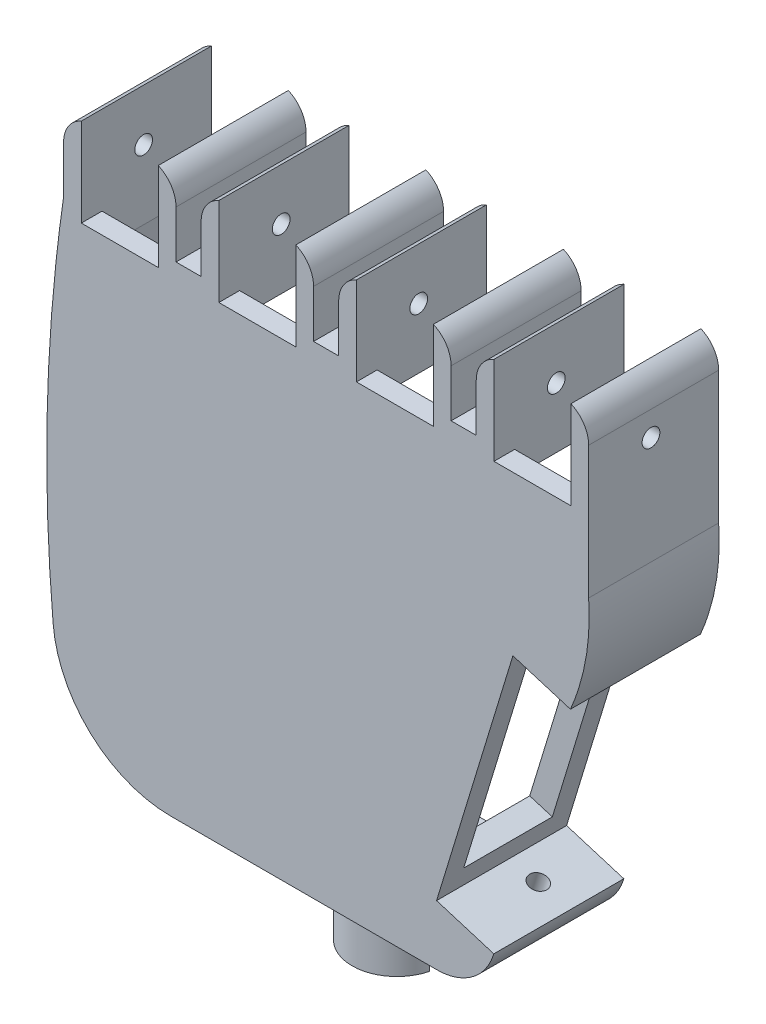
from build123d import *

# Parameters (mm, degrees)
BOSS_EXTRUDE3_DEPTH      = 22
SHELL4_DEPTH             = 18
FILLET1_R                = 5
FILLET2_R                = 5
SKETCH31_W               = 1.5
SKETCH31_H               = 76.806640353
F_3_0_3_DIAMETER_HOLE7_D = 3
SKETCH37_W               = 15
SKETCH37_H               = 36.56625109
CUT_EXTRUDE1_DEPTH       = 10
SKETCH41_W               = 13.02442257
SKETCH41_H               = 15
CUT_EXTRUDE2_DEPTH       = 10
SKETCH41_3_W             = 13.02442257
SKETCH41_3_H             = 15
SKETCH41_3_W_2           = 13.024422569
CUT_EXTRUDE3_DEPTH       = 10
SKETCH44_R               = 7.6
BOSS_EXTRUDE4_DEPTH      = 10
CUT_EXTRUDE12_DEPTH      = 2
CUT_EXTRUDE15_DEPTH      = 12
CUT_EXTRUDE15_DEPTH_BACK = 8
SKETCH65_R               = 2
CUT_EXTRUDE16_START      = -15
SKETCH66_W               = 24.080124388
SKETCH66_H               = 1.338456146
SKETCH66_W_2             = 24.117878097
SKETCH66_H_2             = 1.371234816
CUT_EXTRUDE16_DEPTH      = 10.176313


# Read off the part's stored shape, not the designer's step: Shell4
with BuildPart() as part:
    # Sketch3 → Boss-Extrude3 (new body)
    with BuildSketch(Plane.XY):
        with BuildLine():
            Line((-47.418265466, -62.043210219), (-2.360270573, -62.043210219))
            ThreePointArc((-2.360270573, -62.043210219), (3.711249355, -59.989067364), (7.288415427, -54.670539374))
            Line((7.288415427, -54.670539374), (-2.39285592, -51.717270677))
            Line((-2.39285592, -51.717270677), (10.318728653, -10.046731303))
            Line((10.318728653, -10.046731303), (20, -13))
            add(Edge.make_bspline(
                [(23.274501304, 5.279065965), (23.919221397, -4.143444375), (20, -13)],
                knots=[0, 0, 0, 1, 1, 1], degree=2))
            Line((23.274501304, 5.279065965), (23.274501304, 32.247436741))
            Line((23.274501304, 32.247436741), (20.274501304, 32.247436741))
            Line((20.274501304, 32.247436741), (20.274501304, 17.29592652))
            Line((20.274501304, 17.29592652), (7.250078734, 17.29592652))
            Line((7.250078734, 17.29592652), (7.250078734, 32.247436741))
            Line((7.250078734, 32.247436741), (4.250078734, 32.247436741))
            Line((4.250078734, 32.247436741), (4.250078734, 19.60306742))
            Line((4.250078734, 19.60306742), (0, 19.60306742))
            Line((0, 19.60306742), (0, 32.247436741))
            Line((0, 32.247436741), (-3, 32.247436741))
            Line((-3, 32.247436741), (-3, 17.29592652))
            Line((-3, 17.29592652), (-16.02442257, 17.29592652))
            Line((-16.02442257, 17.29592652), (-16.02442257, 32.247436741))
            Line((-16.02442257, 32.247436741), (-19.02442257, 32.247436741))
            Line((-19.02442257, 32.247436741), (-19.02442257, 19.60306742))
            Line((-19.02442257, 19.60306742), (-23.274501304, 19.60306742))
            Line((-23.274501304, 19.60306742), (-23.274501304, 32.247436741))
            Line((-23.274501304, 32.247436741), (-26.274501304, 32.247436741))
            Line((-26.274501304, 32.247436741), (-26.274501304, 17.29592652))
            Line((-26.274501304, 17.29592652), (-39.298923873, 17.29592652))
            Line((-39.298923873, 17.29592652), (-39.298923873, 32.247436741))
            Line((-39.298923873, 32.247436741), (-42.298923873, 32.247436741))
            Line((-42.298923873, 32.247436741), (-42.298923873, 19.60306742))
            Line((-42.298923873, 19.60306742), (-46.549002607, 19.60306742))
            Line((-46.549002607, 19.60306742), (-46.549002607, 32.247436741))
            Line((-46.549002607, 32.247436741), (-49.549002607, 32.247436741))
            Line((-49.549002607, 32.247436741), (-49.549002607, 17.29592652))
            Line((-49.549002607, 17.29592652), (-62.573425177, 17.29592652))
            Line((-62.573425177, 17.29592652), (-62.573425177, 32.247436741))
            Line((-62.573425177, 32.247436741), (-65.573425177, 32.247436741))
            Line((-65.573425177, 32.247436741), (-65.573425177, 19.633367065))
            add(Edge.make_bspline(
                [(-67.351097818, -43.680950857), (-70.164985361, -11.90807479), (-65.573425177, 19.633367065)],
                knots=[0, 0, 0, 1, 1, 1], degree=2))
            ThreePointArc((-67.351097818, -43.680950857), (-60.969006907, -56.752982698), (-47.418265466, -62.043210219))
        make_face()
    extrude(amount=BOSS_EXTRUDE3_DEPTH)

    # Shell4 outline → Shell4 (cut)
    with BuildSketch(Plane.XY):
        with BuildLine():
            add(Edge.make_bspline(
                [(-63.364450935, -43.353395604), (-63.364595365, -43.351764773), (-63.364739796, -43.350133942), (-63.364884226, -43.34850311), (-63.365028657, -43.346872279), (-63.365173088, -43.345241448), (-63.365317518, -43.343610617), (-63.365461949, -43.341979785), (-63.365606379, -43.340348954), (-63.36575081, -43.338718123), (-63.365895241, -43.337087292), (-63.366039671, -43.335456461), (-63.366184102, -43.333825629), (-63.366328532, -43.332194798), (-63.366497989, -43.330281389), (-63.366523619, -43.329991991), (-63.366543396, -43.32976867), (-63.366591097, -43.329230081), (-63.366553378, -43.329655959), (-63.366699434, -43.328006757), (-63.36655697, -43.3296155), (-63.366747721, -43.3274614), (-63.366658887, -43.328464752), (-63.366736184, -43.327591762), (-63.366744675, -43.327495954), (-63.366772382, -43.327183078), (-63.366796771, -43.326907676), (-63.366846096, -43.326350692), (-63.366870758, -43.3260722), (-63.36689542, -43.325793707), (-63.366920082, -43.325515216), (-63.366944742, -43.325236723), (-63.366969405, -43.324958233), (-63.366994063, -43.324679738), (-63.367018726, -43.324401249), (-63.367043384, -43.324122755), (-63.367068045, -43.323844264), (-63.367092704, -43.323565772), (-63.367117363, -43.32328728), (-63.367142021, -43.323008788), (-63.367215997, -43.322173312), (-63.367265313, -43.321616329), (-63.367314626, -43.321059345), (-63.367363941, -43.320502362), (-63.36741325, -43.319945377), (-63.367462565, -43.319388395), (-63.367511869, -43.318831409), (-63.367561182, -43.318274428), (-63.367610485, -43.317717443), (-63.367659793, -43.317160461), (-63.367709096, -43.316603477), (-63.3677584, -43.316046494), (-63.367807702, -43.31548951), (-63.367955604, -43.313818561), (-63.368054201, -43.312704595), (-63.368152791, -43.311590628), (-63.368251379, -43.310476663), (-63.368349958, -43.309362696), (-63.368448538, -43.308248732), (-63.368547106, -43.307134765), (-63.368645676, -43.306020802), (-63.368744234, -43.304906835), (-63.368842793, -43.303792872), (-63.368941344, -43.302678906), (-63.369039891, -43.301564942), (-63.369138432, -43.300450978), (-63.369434042, -43.297109086), (-63.369631096, -43.294881159), (-63.369828129, -43.292653232), (-63.370025143, -43.290425306), (-63.370222136, -43.28819738), (-63.370419111, -43.285969457), (-63.370616064, -43.283741532), (-63.370812999, -43.28151361), (-63.371009912, -43.279285687), (-63.371206807, -43.277057766), (-63.371403681, -43.274829845), (-63.371600536, -43.272601925), (-63.37179737, -43.270374005), (-63.372387814, -43.263690249), (-63.372781363, -43.259234415), (-63.373174834, -43.254778584), (-63.373568223, -43.250322754), (-63.373961536, -43.24586693), (-63.374354764, -43.241411105), (-63.374747919, -43.236955287), (-63.375140988, -43.232499469), (-63.375533983, -43.228043656), (-63.375926894, -43.223587844), (-63.376319728, -43.219132036), (-63.376712481, -43.21467623), (-63.377105155, -43.210220428), (-63.379068126, -43.18794143), (-63.38063723, -43.170118278), (-63.382205058, -43.152295172), (-63.383771615, -43.134472114), (-63.385336895, -43.1166491), (-63.386900906, -43.098826136), (-63.388463637, -43.081003214), (-63.390025101, -43.063180342), (-63.391585284, -43.045357513), (-63.393144199, -43.027534734), (-63.394701837, -43.009711999), (-63.396258203, -42.991889311), (-63.397813294, -42.97406667), (-63.405582383, -42.884953694), (-63.411777273, -42.813664056), (-63.417951783, -42.74237516), (-63.424105911, -42.671087004), (-63.430239661, -42.599799592), (-63.436353028, -42.528512918), (-63.442446018, -42.457226988), (-63.448518625, -42.385941795), (-63.454570854, -42.314657346), (-63.460602702, -42.243373634), (-63.466614171, -42.172090663), (-63.472605259, -42.100808432), (-63.478575968, -42.029526939), (-63.496426957, -41.815684679), (-63.508246098, -41.673126128), (-63.519983721, -41.530570532), (-63.531639826, -41.388017886), (-63.543214418, -41.245468192), (-63.554707489, -41.102921442), (-63.566119052, -40.960377642), (-63.577449093, -40.81783678), (-63.588697627, -40.675298864), (-63.599864644, -40.532763885), (-63.610950151, -40.390231844), (-63.621954144, -40.247702737), (-63.632876627, -40.105176563), (-63.665399546, -39.677606835), (-63.68675545, -39.392572073), (-63.707785318, -39.107549017), (-63.728489155, -38.822537651), (-63.748866964, -38.537537956), (-63.768918753, -38.252549918), (-63.788644522, -37.967573516), (-63.80804428, -37.682608738), (-63.827118029, -37.397655561), (-63.845865776, -37.112713974), (-63.864287524, -36.827783955), (-63.882383278, -36.54286549), (-63.900153043, -36.25795856), (-63.952484385, -35.403272329), (-63.986068018, -34.833527586), (-64.018347752, -34.263828782), (-64.049323614, -33.694175776), (-64.078995638, -33.124568429), (-64.107363843, -32.555006597), (-64.13442827, -31.985490145), (-64.160188937, -31.416018928), (-64.18464588, -30.84659281), (-64.207799123, -30.277211648), (-64.229648698, -29.707875302), (-64.250194633, -29.138583632), (-64.269436956, -28.569336498), (-64.323253177, -26.861728284), (-64.353916276, -25.723500379), (-64.379365176, -24.585448901), (-64.399600038, -23.447572701), (-64.414621012, -22.309870633), (-64.424428214, -21.17234154), (-64.429021763, -20.034984272), (-64.428401733, -18.897797666), (-64.422568206, -17.760780568), (-64.411521224, -16.623931812), (-64.395260823, -15.487250235), (-64.373787013, -14.350734667), (-64.347099789, -13.214383941), (-64.283298466, -10.942009826), (-64.246184365, -9.805986448), (-64.203856801, -8.67012558), (-64.156315726, -7.53442605), (-64.103561082, -6.398886692), (-64.045592777, -5.263506344), (-63.982410723, -4.128283846), (-63.914014787, -2.993218041), (-63.840404842, -1.858307774), (-63.761580723, -0.723551895), (-63.67754226, 0.411050743), (-63.588289254, 1.545501286), (-63.493821495, 2.679800874), (-63.344297377, 4.381025532), (-63.293152271, 4.948062967), (-63.240703395, 5.515063091), (-63.186950716, 6.082026042), (-63.131894198, 6.648951961), (-63.075533806, 7.215840985), (-63.017869505, 7.782693255), (-62.958901261, 8.34950891), (-62.898629039, 8.916288089), (-62.837052802, 9.483030931), (-62.774172518, 10.049737576), (-62.70998815, 10.616408162), (-62.644499664, 11.18304283), (-62.564685885, 11.860099446), (-62.55161518, 11.970555814), (-62.538494911, 12.081010823), (-62.525325076, 12.191464474), (-62.512105676, 12.301916769), (-62.49883671, 12.412367707), (-62.485518177, 12.522817291), (-62.472150078, 12.633265521), (-62.458732412, 12.743712397), (-62.445265178, 12.854157922), (-62.431748377, 12.964602096), (-62.418182008, 13.07504492), (-62.404566071, 13.185486395), (-62.390900565, 13.295926522)],
                knots=[-0.000398357, -0.000398357, -0.000398357, -0.000398357, -0.000398357, -0.000398357, -0.000398357, -0.000398357, -0.000398357, -0.000398357, -0.000398357, -0.000398357, -0.000398357, -0.000398357, -0.000398357, -3.9063e-05, -3.9063e-05, -3.9063e-05, -3.9063e-05, -3.9063e-05, -3.9063e-05, -3.9063e-05, -3.9063e-05, -3.9063e-05, -3.9063e-05, -3.9063e-05, -3.9063e-05, -3.9063e-05, 2.3193e-05, 2.3193e-05, 2.3193e-05, 2.3193e-05, 2.3193e-05, 2.3193e-05, 2.3193e-05, 2.3193e-05, 2.3193e-05, 2.3193e-05, 2.3193e-05, 2.3193e-05, 2.3193e-05, 8.5449e-05, 8.5449e-05, 8.5449e-05, 8.5449e-05, 8.5449e-05, 8.5449e-05, 8.5449e-05, 8.5449e-05, 8.5449e-05, 8.5449e-05, 8.5449e-05, 8.5449e-05, 8.5449e-05, 0.000209961, 0.000209961, 0.000209961, 0.000209961, 0.000209961, 0.000209961, 0.000209961, 0.000209961, 0.000209961, 0.000209961, 0.000209961, 0.000209961, 0.000209961, 0.000458984, 0.000458984, 0.000458984, 0.000458984, 0.000458984, 0.000458984, 0.000458984, 0.000458984, 0.000458984, 0.000458984, 0.000458984, 0.000458984, 0.000458984, 0.000957031, 0.000957031, 0.000957031, 0.000957031, 0.000957031, 0.000957031, 0.000957031, 0.000957031, 0.000957031, 0.000957031, 0.000957031, 0.000957031, 0.000957031, 0.001953125, 0.001953125, 0.001953125, 0.001953125, 0.001953125, 0.001953125, 0.001953125, 0.001953125, 0.001953125, 0.001953125, 0.001953125, 0.001953125, 0.001953125, 0.0059375, 0.0059375, 0.0059375, 0.0059375, 0.0059375, 0.0059375, 0.0059375, 0.0059375, 0.0059375, 0.0059375, 0.0059375, 0.0059375, 0.0059375, 0.021875, 0.021875, 0.021875, 0.021875, 0.021875, 0.021875, 0.021875, 0.021875, 0.021875, 0.021875, 0.021875, 0.021875, 0.021875, 0.05375, 0.05375, 0.05375, 0.05375, 0.05375, 0.05375, 0.05375, 0.05375, 0.05375, 0.05375, 0.05375, 0.05375, 0.05375, 0.1175, 0.1175, 0.1175, 0.1175, 0.1175, 0.1175, 0.1175, 0.1175, 0.1175, 0.1175, 0.1175, 0.1175, 0.1175, 0.245, 0.245, 0.245, 0.245, 0.245, 0.245, 0.245, 0.245, 0.245, 0.245, 0.245, 0.245, 0.245, 0.5, 0.5, 0.5, 0.5, 0.5, 0.5, 0.5, 0.5, 0.5, 0.5, 0.5, 0.5, 0.5, 0.755, 0.755, 0.755, 0.755, 0.755, 0.755, 0.755, 0.755, 0.755, 0.755, 0.755, 0.755, 0.755, 0.8825, 0.8825, 0.8825, 0.8825, 0.8825, 0.8825, 0.8825, 0.8825, 0.8825, 0.8825, 0.8825, 0.8825, 0.8825, 0.907355962, 0.907355962, 0.907355962, 0.907355962, 0.907355962, 0.907355962, 0.907355962, 0.907355962, 0.907355962, 0.907355962, 0.907355962, 0.907355962, 0.907355962, 0.907355962, 0.907355962], degree=14))
            ThreePointArc((-63.364450935, -43.353395604), (-58.258858809, -53.811028027), (-47.418265466, -58.043210219))
            Line((-47.418265466, -58.043210219), (-2.360270573, -58.043210219))
            ThreePointArc((-2.360270573, -58.043210219), (-0.556542867, -57.765671784), (1.080316917, -56.95873234))
            Line((1.080316917, -56.95873234), (-7.385906512, -54.376113618))
            Line((-7.385906512, -54.376113618), (7.659885711, -5.053680712))
            Line((7.659885711, -5.053680712), (17.616723286, -8.091011005))
            add(Edge.make_bspline(
                [(19.274501304, 5.142378983), (19.275102291, 5.133595627), (19.275703278, 5.124812271), (19.276304265, 5.116028915), (19.276905252, 5.107245559), (19.277506239, 5.098462203), (19.278107226, 5.089678846), (19.278708213, 5.08089549), (19.2793092, 5.072112134), (19.279910187, 5.063328778), (19.280511174, 5.054545422), (19.281343399, 5.042382543), (19.281574637, 5.039003021), (19.281805876, 5.035623498), (19.282037114, 5.032243976), (19.282268353, 5.028864453), (19.282499591, 5.025484931), (19.282730829, 5.022105408), (19.282962068, 5.018725886), (19.283193306, 5.015346363), (19.283424544, 5.01196684), (19.283670235, 5.008376098), (19.283684688, 5.008164878), (19.28369914, 5.007953657), (19.283713592, 5.007742437), (19.283728045, 5.007531217), (19.283742497, 5.007319997), (19.28375695, 5.007108777), (19.283771402, 5.006897557), (19.283785854, 5.006686337), (19.283800307, 5.006475116), (19.283818372, 5.006211091), (19.283821574, 5.006164302), (19.283828175, 5.006067824), (19.2838216, 5.006163913), (19.283845545, 5.005813962), (19.283824823, 5.006116819), (19.283845192, 5.005819123), (19.283840593, 5.005886341), (19.283846032, 5.00580684), (19.283848985, 5.005763684), (19.283855479, 5.005668764), (19.283858725, 5.005621305), (19.283861972, 5.005573845), (19.283865219, 5.005526385), (19.283868466, 5.005478926), (19.283871712, 5.005431466), (19.283874959, 5.005384006), (19.283878205, 5.005336547), (19.283881452, 5.005289087), (19.283884698, 5.005241628), (19.283894437, 5.005099249), (19.283900929, 5.00500433), (19.283907421, 5.004909411), (19.283913913, 5.004814492), (19.283920404, 5.004719573), (19.283926895, 5.004624654), (19.283933386, 5.004529735), (19.283939876, 5.004434816), (19.283946366, 5.004339898), (19.283952856, 5.004244979), (19.283985305, 5.003770386), (19.284011259, 5.003390712), (19.284037208, 5.00301104), (19.284063153, 5.002631368), (19.284089093, 5.002251697), (19.284115029, 5.001872027), (19.28414096, 5.001492357), (19.284166887, 5.001112689), (19.284192809, 5.000733021), (19.284218727, 5.000353354), (19.284296466, 4.999214357), (19.284348274, 4.998455029), (19.284400063, 4.997695704), (19.284451835, 4.996936382), (19.284503588, 4.996177064), (19.284555323, 4.995417749), (19.28460704, 4.994658438), (19.284658738, 4.99389913), (19.284710419, 4.993139826), (19.284762081, 4.992380525), (19.284917012, 4.990102632), (19.285020227, 4.988584051), (19.285123369, 4.987065483), (19.285226438, 4.985546929), (19.285329435, 4.984028389), (19.285432358, 4.982509862), (19.285535209, 4.980991349), (19.285637986, 4.97947285), (19.285740691, 4.977954364), (19.285843323, 4.976435893), (19.286356118, 4.968843601), (19.286765189, 4.962769987), (19.287173093, 4.956696591), (19.287579832, 4.950623414), (19.287985405, 4.944550456), (19.288389812, 4.938477716), (19.288793054, 4.932405194), (19.289195129, 4.926332891), (19.28959604, 4.920260806), (19.289995784, 4.914188939), (19.29198868, 4.883830696), (19.293564348, 4.859547592), (19.295121369, 4.835267972), (19.296659746, 4.810991833), (19.298179481, 4.78671917), (19.299680576, 4.762449978), (19.301163035, 4.738184253), (19.302626857, 4.713921988), (19.304072047, 4.689663181), (19.305498607, 4.665407825), (19.3097224, 4.592652101), (19.312463749, 4.544162074), (19.315130603, 4.495685799), (19.317722977, 4.447223235), (19.32024089, 4.398774344), (19.322684358, 4.350339087), (19.325053398, 4.301917425), (19.327348027, 4.253509318), (19.329568261, 4.205114728), (19.331714118, 4.156733616), (19.337928608, 4.011630594), (19.341774175, 3.914949011), (19.345322431, 3.818320865), (19.34857349, 3.721745829), (19.351527467, 3.625223572), (19.354184477, 3.528753768), (19.356544635, 3.432336088), (19.358608055, 3.335970204), (19.360374851, 3.239655787), (19.361845139, 3.14339251), (19.365366822, 2.854755111), (19.366528944, 2.662533376), (19.366506208, 2.470512121), (19.365299358, 2.278688603), (19.362909074, 2.087060051), (19.359335972, 1.895623668), (19.354580602, 1.704376631), (19.348643452, 1.51331609), (19.341524944, 1.322439167), (19.333225436, 1.131742959), (19.304784792, 0.560187688), (19.281101528, 0.179862442), (19.252697734, -0.199775074), (19.219574609, -0.578748656), (19.181732242, -0.957082024), (19.139169615, -1.334798823), (19.0918846, -1.711922625), (19.039873962, -2.088476922), (18.983133357, -2.464485136), (18.921657333, -2.839970612), (18.776632249, -3.661233316), (18.691108657, -4.106801597), (18.598857848, -4.551700252), (18.499866868, -4.995966926), (18.394120679, -5.439638014), (18.281602335, -5.882748552), (18.162293154, -6.325332116), (18.036172889, -6.767420711), (17.903219902, -7.20904467), (17.763411336, -7.650232546), (17.616723286, -8.091011005)],
                knots=[-0.007236295, -0.007236295, -0.007236295, -0.007236295, -0.007236295, -0.007236295, -0.007236295, -0.007236295, -0.007236295, -0.007236295, -0.007236295, -0.007236295, -0.002109375, -0.002109375, -0.002109375, -0.002109375, -0.002109375, -0.002109375, -0.002109375, -0.002109375, -0.002109375, -0.002109375, -0.000136719, -0.000136719, -0.000136719, -0.000136719, -0.000136719, -0.000136719, -0.000136719, -0.000136719, -0.000136719, -0.000136719, -1.3428e-05, -1.3428e-05, -1.3428e-05, -1.3428e-05, -1.3428e-05, -1.3428e-05, -1.3428e-05, -1.3428e-05, -1.3428e-05, -1.3428e-05, 1.7395e-05, 1.7395e-05, 1.7395e-05, 1.7395e-05, 1.7395e-05, 1.7395e-05, 1.7395e-05, 1.7395e-05, 1.7395e-05, 1.7395e-05, 4.8218e-05, 4.8218e-05, 4.8218e-05, 4.8218e-05, 4.8218e-05, 4.8218e-05, 4.8218e-05, 4.8218e-05, 4.8218e-05, 4.8218e-05, 0.000109863, 0.000109863, 0.000109863, 0.000109863, 0.000109863, 0.000109863, 0.000109863, 0.000109863, 0.000109863, 0.000109863, 0.000356445, 0.000356445, 0.000356445, 0.000356445, 0.000356445, 0.000356445, 0.000356445, 0.000356445, 0.000356445, 0.000356445, 0.000849609, 0.000849609, 0.000849609, 0.000849609, 0.000849609, 0.000849609, 0.000849609, 0.000849609, 0.000849609, 0.000849609, 0.001835937, 0.001835937, 0.001835937, 0.001835937, 0.001835937, 0.001835937, 0.001835937, 0.001835937, 0.001835937, 0.001835937, 0.00578125, 0.00578125, 0.00578125, 0.00578125, 0.00578125, 0.00578125, 0.00578125, 0.00578125, 0.00578125, 0.00578125, 0.0215625, 0.0215625, 0.0215625, 0.0215625, 0.0215625, 0.0215625, 0.0215625, 0.0215625, 0.0215625, 0.0215625, 0.053125, 0.053125, 0.053125, 0.053125, 0.053125, 0.053125, 0.053125, 0.053125, 0.053125, 0.053125, 0.11625, 0.11625, 0.11625, 0.11625, 0.11625, 0.11625, 0.11625, 0.11625, 0.11625, 0.11625, 0.2425, 0.2425, 0.2425, 0.2425, 0.2425, 0.2425, 0.2425, 0.2425, 0.2425, 0.2425, 0.495, 0.495, 0.495, 0.495, 0.495, 0.495, 0.495, 0.495, 0.495, 0.495, 0.795504191, 0.795504191, 0.795504191, 0.795504191, 0.795504191, 0.795504191, 0.795504191, 0.795504191, 0.795504191, 0.795504191, 0.795504191, 0.795504191], degree=11))
            Line((19.274501304, 5.142378983), (19.274501304, 13.29592652))
            Line((19.274501304, 13.29592652), (3.250078734, 13.29592652))
            Line((3.250078734, 13.29592652), (3.250078734, 15.60306742))
            Line((3.250078734, 15.60306742), (1, 15.60306742))
            Line((1, 15.60306742), (1, 13.29592652))
            Line((1, 13.29592652), (-20.02442257, 13.29592652))
            Line((-20.02442257, 13.29592652), (-20.02442257, 15.60306742))
            Line((-20.02442257, 15.60306742), (-22.274501304, 15.60306742))
            Line((-22.274501304, 15.60306742), (-22.274501304, 13.29592652))
            Line((-22.274501304, 13.29592652), (-43.298923873, 13.29592652))
            Line((-43.298923873, 13.29592652), (-43.298923873, 15.60306742))
            Line((-43.298923873, 15.60306742), (-45.549002607, 15.60306742))
            Line((-45.549002607, 15.60306742), (-45.549002607, 13.29592652))
            Line((-45.549002607, 13.29592652), (-62.390900565, 13.295926522))
        make_face()
    extrude(amount=SHELL4_DEPTH, mode=Mode.SUBTRACT)

    # Fillet1
    # the kernel refuses this fillet: 5 mm, written as the material it takes off along each edge
    with BuildSketch(Plane(origin=(-65.573425177, 32.247436741, -11.456439237), x_dir=(0, -1, 0), z_dir=(0, 0, 1))) as fillet1_piece_1:
        with BuildLine():
            CenterArc((4.582575695, 5), FILLET1_R, 203.578178478, 66.421821522)
            Line((0, 3), (-0.091651514, 2.96))
            ThreePointArc((-0.091651514, 2.96), (-0.1, 1.5), (-0.1, 0))
            Line((-0.1, 0), (0, -0.1))
            Line((0, -0.1), (4.582575695, -0.1))
            Line((4.582575695, -0.1), (4.582575695, 0))
        make_face()
    extrude(amount=44.912878475, mode=Mode.SUBTRACT)

    # Fillet2
    # the kernel refuses this fillet: 5 mm, written as the material it takes off along each edge
    with BuildSketch(Plane(origin=(23.274501304, 32.247436741, -11.456439237), x_dir=(-1, 0, 0), z_dir=(0, 0, 1)), Plane(origin=(0, 32.247436741, -11.456439237), x_dir=(-1, 0, 0), z_dir=(0, 0, 1)), Plane(origin=(-23.274501304, 32.247436741, -11.456439237), x_dir=(-1, 0, 0), z_dir=(0, 0, 1)), Plane(origin=(-46.549002607, 32.247436741, -11.456439237), x_dir=(-1, 0, 0), z_dir=(0, 0, 1))) as fillet2_piece_1:
        with BuildLine():
            CenterArc((5, 4.582575695), FILLET2_R, 180, 66.421821522)
            Line((0, 4.582575695), (-0.1, 4.582575695))
            Line((-0.1, 4.582575695), (-0.1, 0))
            Line((-0.1, 0), (0, -0.1))
            ThreePointArc((0, -0.1), (1.5, -0.1), (2.96, -0.091651514))
            Line((2.96, -0.091651514), (3, 0))
        make_face()
    extrude(amount=44.912878475, mode=Mode.SUBTRACT)
    with BuildSketch(Plane(origin=(4.250078734, 32.247436741, -11.456439237), x_dir=(0, -1, 0), z_dir=(0, 0, 1)), Plane(origin=(-19.02442257, 32.247436741, -11.456439237), x_dir=(0, -1, 0), z_dir=(0, 0, 1)), Plane(origin=(-42.298923873, 32.247436741, -11.456439237), x_dir=(0, -1, 0), z_dir=(0, 0, 1))) as fillet2_piece_2:
        with BuildLine():
            CenterArc((4.582575695, 5), FILLET2_R, 203.578178478, 66.421821522)
            Line((0, 3), (-0.091651514, 2.96))
            ThreePointArc((-0.091651514, 2.96), (-0.1, 1.5), (-0.1, 0))
            Line((-0.1, 0), (0, -0.1))
            Line((0, -0.1), (4.582575695, -0.1))
            Line((4.582575695, -0.1), (4.582575695, 0))
        make_face()
    extrude(amount=44.912878475, mode=Mode.SUBTRACT)

    # Sketch31 → Ø3.0 (3) Diameter Hole6 (revolve, cut)
    with BuildSketch(Plane(origin=(15.986108456, -7.59359227, 9.287077149), x_dir=(-0.9564866916683916, 0.291775956276824, 0), z_dir=(0, 0, 1))):
        with Locations((0.75, 38.403320177)):
            Rectangle(SKETCH31_W, SKETCH31_H)
    revolve(axis=Axis((17.838885778, -1.519901778, 9.287077149), (-0.291775956276824, -0.9564866916683916, 0)), mode=Mode.SUBTRACT)

    # Ø3.0 (3) Diameter Hole7 (through all)
    with Locations(Plane.ZY.offset(65.573425177)):
        with Locations((11.454144742, 23.506628642)):
            Hole(F_3_0_3_DIAMETER_HOLE7_D / 2)

    # Sketch37 → Cut-Extrude1 (cut)
    with BuildSketch(Plane(origin=(12.244102128, -3.735059399, 0), x_dir=(0, 0, -1), z_dir=(0.9564866916683918, -0.2917759562768239, 0))):
        with Locations((-11, -28.381933411)):
            Rectangle(SKETCH37_W, SKETCH37_H)
    extrude(amount=-CUT_EXTRUDE1_DEPTH, mode=Mode.SUBTRACT)

    # Sketch41 → Cut-Extrude2 (cut)
    with BuildSketch(Plane(origin=(0, 17.29592652, 0), x_dir=(1, 0, 0), z_dir=(0, 1, 0))):
        with Locations((13.762290019, -11)):
            Rectangle(SKETCH41_W, SKETCH41_H)
    extrude(amount=-CUT_EXTRUDE2_DEPTH, mode=Mode.SUBTRACT)

    # Sketch41<3> → Cut-Extrude3 (cut)
    with BuildSketch(Plane(origin=(0, 17.29592652, 0), x_dir=(1, 0, 0), z_dir=(0, 1, 0))):
        with Locations((13.762290019, -11)):
            Rectangle(SKETCH41_3_W, SKETCH41_3_H)
        with Locations((-9.512211285, -11)):
            Rectangle(SKETCH41_3_W, SKETCH41_3_H)
        with Locations((-32.786712589, -11)):
            Rectangle(SKETCH41_3_W_2, SKETCH41_3_H)
        with Locations((-56.061213892, -11)):
            Rectangle(SKETCH41_3_W, SKETCH41_3_H)
    extrude(amount=-CUT_EXTRUDE3_DEPTH, mode=Mode.SUBTRACT)

    # Sketch44 → Boss-Extrude4 (add)
    with BuildSketch(Plane.XZ.offset(62.043210219)):
        with Locations(Location((-20.159055766, 11, 0), (0, 0, 180))):
            Circle(SKETCH44_R)
    extrude(amount=BOSS_EXTRUDE4_DEPTH)

    # Sketch60 → Cut-Extrude12 (cut)
    with BuildSketch(Plane.XZ.offset(72.043210219)):
        Polygon((-17.829586753, 12.755346717), (-18.371554549, 12.626145646), (-18.193539013, 13.154421007), (-18.702538143, 12.927833508), (-18.624624003, 13.479824247), (-19.083321112, 13.163566486), (-19.108161641, 13.720475218), (-19.500936349, 13.325316974), (-19.627685631, 13.868178842), (-19.941162466, 13.407576755), (-20.165504208, 13.917905249), (-20.389008093, 13.40754457), (-20.703302604, 13.867961064), (-20.829222382, 13.325221515), (-21.222766742, 13.720047079), (-21.246814365, 13.163411003), (-21.706206891, 13.479200325), (-21.627563448, 12.927623297), (-22.137160078, 13.15362255), (-21.958503677, 12.625887864), (-22.50095071, 12.754400916), (-22.228365279, 12.268479943), (-22.785190332, 12.295130435), (-22.427958441, 11.867570632), (-22.980974102, 11.78872207), (-22.550486258, 11.436812417), (-23.079266939, 11.261276097), (-22.591776191, 10.990874251), (-23.079298663, 10.721163576), (-22.550422162, 10.544942025), (-22.980084431, 10.190241667), (-22.427832432, 10.114201425), (-22.785002865, 9.68659028), (-22.228181648, 9.713320806), (-22.500697234, 9.227360659), (-21.958268678, 9.355951677), (-22.136849225, 8.828191317), (-21.627285083, 9.054263814), (-21.705849246, 8.502675488), (-21.246502114, 8.818530837), (-21.222374483, 8.261898223), (-20.828886878, 8.656780348), (-20.702889092, 8.114058903), (-20.38866076, 8.574520567), (-20.165083522, 8.064192019), (-19.940815134, 8.574552752), (-19.627272098, 8.113995727), (-19.500600844, 8.656875807), (-19.107769343, 8.261774022), (-19.083008861, 8.818686319), (-18.6242663, 8.502494492), (-18.702259778, 9.054474025), (-18.193228086, 8.827959689), (-18.37131955, 9.356209458), (-17.829333189, 9.227086287), (-18.101457948, 9.713617379), (-17.544973614, 9.686282507), (-17.901864786, 10.11452669), (-17.349623722, 10.190646309), (-17.779336969, 10.545284906), (-17.250485802, 10.721582472), (-17.738047035, 10.991223071), (-17.250595158, 11.261694984), (-17.779401064, 11.437155298), (-17.349948065, 11.792590959), (-17.901990794, 11.867895898), (-17.545161179, 12.296191373), (-18.101641578, 12.268776517), align=None)
    extrude(amount=-CUT_EXTRUDE12_DEPTH, mode=Mode.SUBTRACT)

    # Sketch65 → Cut-Extrude15 (cut, two sides: drawn at the far end of the back side and taken through both)
    with BuildSketch(Plane.XZ.offset(62.043210219).offset(-CUT_EXTRUDE15_DEPTH_BACK)):
        with Locations(Location((-28.382583724, 11, 0), (0, 0, 180))):
            Circle(SKETCH65_R)
        with Locations(Location((-12.165821488, 11, 0), (0, 0, 180))):
            Circle(SKETCH65_R)
    extrude(amount=CUT_EXTRUDE15_DEPTH + CUT_EXTRUDE15_DEPTH_BACK, mode=Mode.SUBTRACT)

    # Sketch66 → Cut-Extrude16 (cut)
    with BuildSketch(Plane(origin=(26.591402503, -8.111698743, 0), x_dir=(0, 0, -1), z_dir=(0.9564866916683918, -0.2917759562768239, 0)).offset(CUT_EXTRUDE16_START)):
        with Locations((-11.261097587, -6.794935059)):
            Rectangle(SKETCH66_W, SKETCH66_H)
        with Locations((-11.242220733, -49.70415177)):
            Rectangle(SKETCH66_W_2, SKETCH66_H_2)
    extrude(amount=CUT_EXTRUDE16_DEPTH, mode=Mode.SUBTRACT)


solid = part.part
